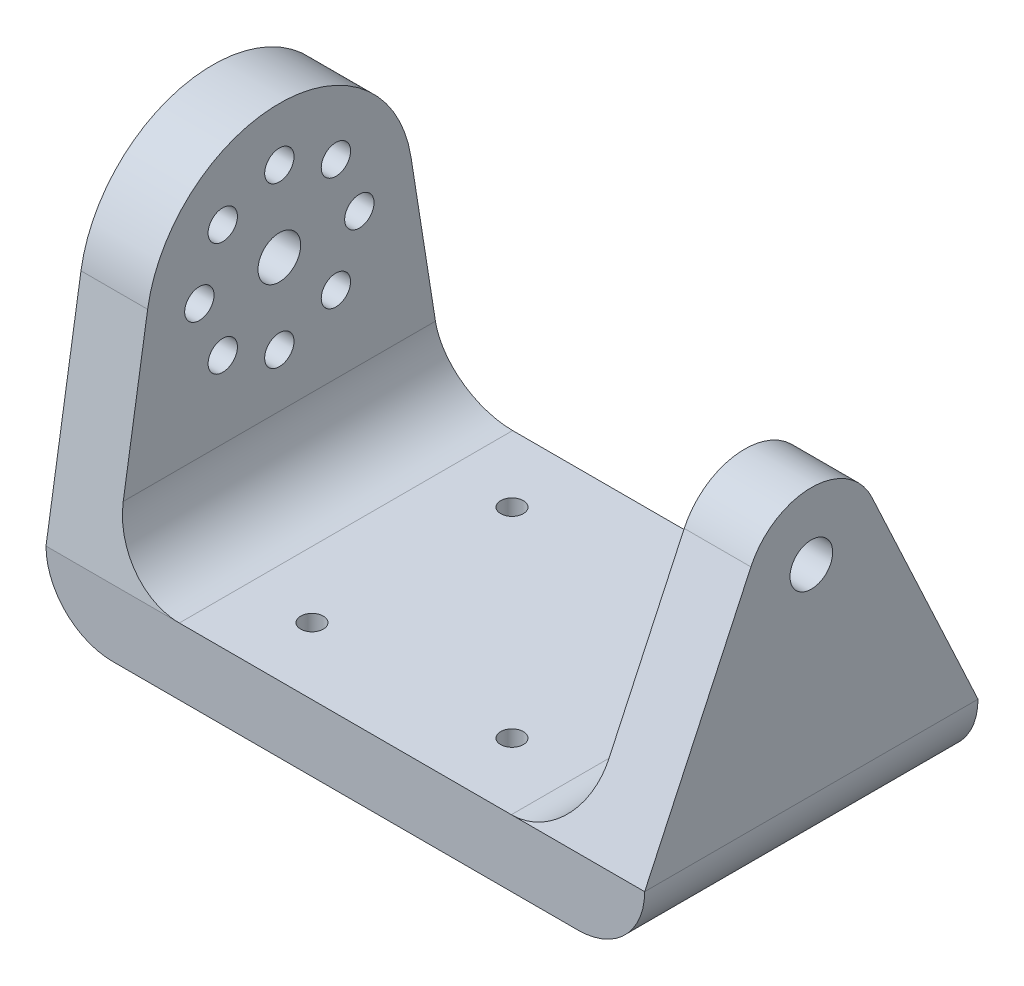
from build123d import *

# Parameters (mm, degrees)
SKETCH_1_W          = 44.9
SKETCH_1_H          = 25
EXTRUDE_1_DEPTH     = 5
SKETCH_2_R          = 1.1
SKETCH_2_R_2        = 1.6
EXTRUDE_2_DEPTH     = 5
EXTRUDE_START       = -5
SKETCH_3_R          = 1.6
EXTRUDE_3_DEPTH     = 5
FILLET_1_R          = 5
SKETCH_4_R          = 0.85
CUT_EXTRUDE_1_DEPTH = 5


with BuildPart() as part:
    # ｽｹｯﾁ1 → ﾎﾞｽ - 押し出し1 (new body)
    with BuildSketch(Plane(origin=(0, 0, 0), x_dir=(1, 0, 0), z_dir=(0, 1, 0))):
        with Locations((0, 12.5)):
            Rectangle(SKETCH_1_W, SKETCH_1_H)
    extrude(amount=EXTRUDE_1_DEPTH)

    # ｽｹｯﾁ2 → ﾎﾞｽ - 押し出し2 (add)
    with BuildSketch(Plane.ZY.offset(22.45)):
        with BuildLine():
            Line((-25, 5), (0, 5))
            Line((0, 5), (-2.623078099, 21.564101584))
            ThreePointArc((-2.623078099, 21.564101584), (-12.5, 30), (-22.376921901, 21.564101584))
            Line((-22.376921901, 21.564101584), (-25, 5))
        make_face()
        with Locations((-12.5, 26)):
            Circle(SKETCH_2_R, mode=Mode.SUBTRACT)
        with Locations((-8.257359313, 24.242640687)):
            Circle(SKETCH_2_R, mode=Mode.SUBTRACT)
        with Locations((-6.5, 20)):
            Circle(SKETCH_2_R, mode=Mode.SUBTRACT)
        with Locations((-8.257359313, 15.757359313)):
            Circle(SKETCH_2_R, mode=Mode.SUBTRACT)
        with Locations((-12.5, 14)):
            Circle(SKETCH_2_R, mode=Mode.SUBTRACT)
        with Locations((-16.742640687, 15.757359313)):
            Circle(SKETCH_2_R, mode=Mode.SUBTRACT)
        with Locations((-18.5, 20)):
            Circle(SKETCH_2_R, mode=Mode.SUBTRACT)
        with Locations((-16.742640687, 24.242640687)):
            Circle(SKETCH_2_R, mode=Mode.SUBTRACT)
        with Locations((-12.5, 20)):
            Circle(SKETCH_2_R_2, mode=Mode.SUBTRACT)
    extrude(amount=-EXTRUDE_2_DEPTH)

    # ｽｹｯﾁ3 → ﾎﾞｽ - 押し出し3 (add)
    with BuildSketch(Plane(origin=(22.45, 0, 0), x_dir=(0, 0, -1), z_dir=(1, 0, 0)).offset(EXTRUDE_START)):
        with BuildLine():
            Line((0, 5), (7.96729454, 22.110587883))
            ThreePointArc((7.96729454, 22.110587883), (12.5, 25), (17.03270546, 22.110587883))
            Line((17.03270546, 22.110587883), (25, 5))
            Line((25, 5), (0, 5))
        make_face()
        with Locations((12.5, 20)):
            Circle(SKETCH_3_R, mode=Mode.SUBTRACT)
    extrude(amount=EXTRUDE_3_DEPTH)

    # ﾌｨﾚｯﾄ1
    fillet_1_edges = [part.edges().sort_by_distance(p)[0] for p in [
        (17.45, 5, -12.5),
        (-17.45, 5, -12.5),
        (22.45, 0, -12.5),
        (-22.45, 0, -12.5),
    ]]
    fillet(fillet_1_edges, radius=FILLET_1_R)

    # ｽｹｯﾁ4 → ｶｯﾄ - 押し出し1 (cut)
    with BuildSketch(Plane(origin=(0, 5, 0), x_dir=(1, 0, 0), z_dir=(0, 1, 0))):
        with Locations((-7.5, 20)):
            Circle(SKETCH_4_R)
        with Locations((7.5, 20)):
            Circle(SKETCH_4_R)
        with Locations((7.5, 5)):
            Circle(SKETCH_4_R)
        with Locations((-7.5, 5)):
            Circle(SKETCH_4_R)
    extrude(amount=-CUT_EXTRUDE_1_DEPTH, mode=Mode.SUBTRACT)


solid = part.part
